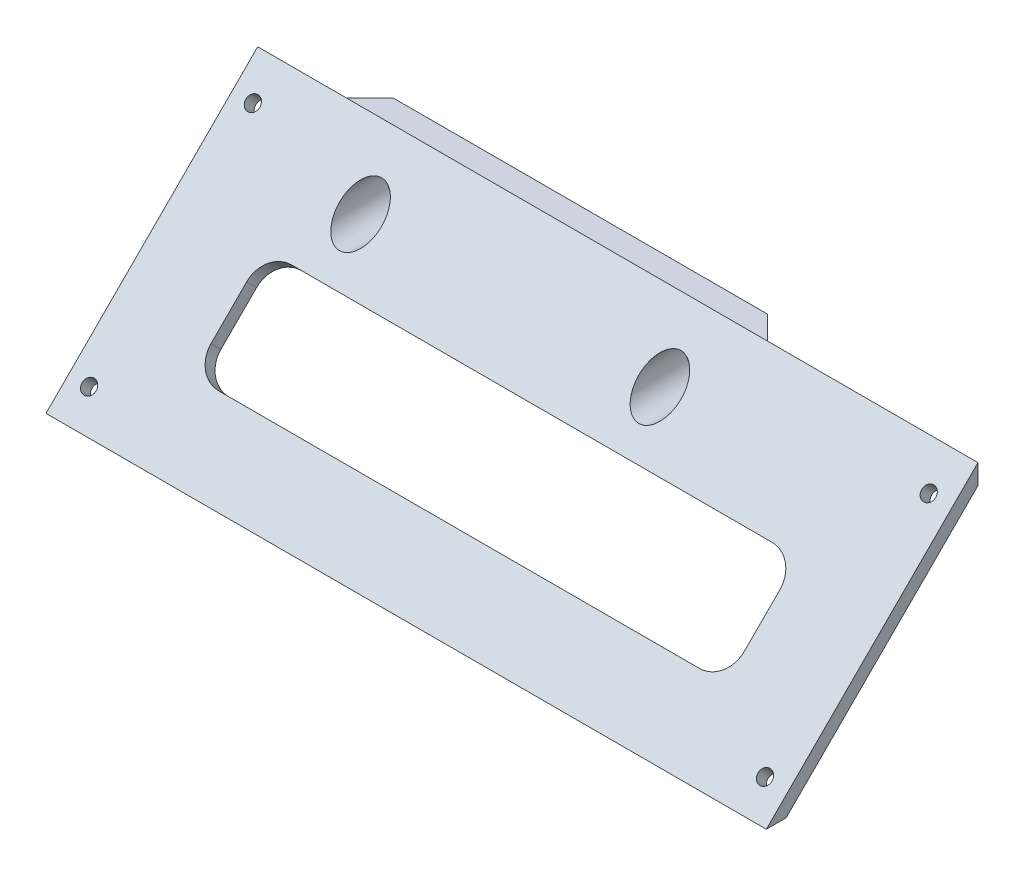
from build123d import *

# Parameters (mm, degrees)
SKETCH1_W                = 80
SKETCH1_H                = 20
BOSS_EXTRUDE1_DEPTH      = 5
BOSS_EXTRUDE2_DEPTH      = 90
BOSS_EXTRUDE2_DEPTH_BACK = 64
SKETCH4_W                = 114
SKETCH4_H                = 22
CUT_EXTRUDE2_DEPTH       = 109.466361883
CHAMFER2_SIZE            = 11.3
CHAMFER2_SIZE_2          = 15.980613255
CHAMFER4_SIZE            = 5
CHAMFER4_SIZE2           = 10.722534603
CUT_EXTRUDE1_DEPTH       = 109.942423601
CUT_EXTRUDE1_DEPTH_BACK  = 109.942423601
SKETCH2_R                = 2.3
SKETCH5_R                = 4.5
CUT_EXTRUDE3_DEPTH       = 107.728174912
SKETCH6_R                = 1.5
CUT_EXTRUDE4_DEPTH       = 5
FILLET2_R                = 5.6


with BuildPart() as part:
    # Sketch1 → Boss-Extrude1 (new body)
    with BuildSketch(Plane.XY):
        Rectangle(SKETCH1_W, SKETCH1_H)
    extrude(amount=BOSS_EXTRUDE1_DEPTH)

    # Sketch3 → Boss-Extrude2 (add, two sides: drawn at the far end of the back side and taken through both)
    with BuildSketch(Plane(origin=(0, 0, 0), x_dir=(0, 0, -1), z_dir=(1, 0, 0)).offset(-BOSS_EXTRUDE2_DEPTH_BACK)):
        Polygon((-5, 10), (-50.254833996, -35.254833996), (-46.012193309, -35.254833996), (-5, 5.757359313), align=None)
    extrude(amount=BOSS_EXTRUDE2_DEPTH + BOSS_EXTRUDE2_DEPTH_BACK)

    # Sketch4 → Cut-Extrude2 (cut, through all)
    with BuildSketch(Plane(origin=(0, 5.378679656, 5.378679656), x_dir=(1, 0, 0), z_dir=(0, -0.7071067811865509, -0.7071067811865441))):
        with Locations((13, 33.464466094)):
            Rectangle(SKETCH4_W, SKETCH4_H)
    extrude(amount=-CUT_EXTRUDE2_DEPTH, mode=Mode.SUBTRACT)

    # Chamfer1
    # the kernel refuses this chamfer: 5 mm, written as the material it adds along each edge
    with BuildSketch(Plane(origin=(40, -25.102836543, 5), x_dir=(-0.027495876610586317, 0, -0.9996219169112968), z_dir=(0, 1, 0))) as chamfer1_piece_1_section:
        with BuildLine():
            Line((5.143365976, 0), (-0.282735774, -5.135588968))
            Line((-0.282735774, -5.135588968), (-0.382697966, -5.13283938))
            ThreePointArc((-0.382697966, -5.13283938), (-0.170646135, -2.566989148), (-0.099962192, 0.002749588))
            Line((-0.099962192, 0.002749588), (0.002749588, 0.099962192))
            ThreePointArc((0.002749588, 0.099962192), (2.572488324, 0.029278248), (5.146115564, 0.099962192))
            Line((5.146115564, 0.099962192), (5.143365976, 0))
        make_face()
    chamfer1_piece_1 = extrude(amount=35.102836543, mode=Mode.PRIVATE)
    chamfer1_piece_1 = split(chamfer1_piece_1, bisect_by=Plane(origin=(41.544288895, -10, 3.190389103), z_dir=(0, 1, 0)), keep=Keep.TOP, mode=Mode.PRIVATE)
    chamfer1_piece_1 = split(chamfer1_piece_1, bisect_by=Plane(origin=(41.544288895, -1.222319508, 0), z_dir=(0, 0, 1)), keep=Keep.TOP, mode=Mode.PRIVATE)
    chamfer1_piece_1 = split(chamfer1_piece_1, bisect_by=Plane(origin=(41.544288895, -1.222319508, 5), z_dir=(0, 0, -1)), keep=Keep.TOP, mode=Mode.PRIVATE)
    chamfer1_piece_1 = split(chamfer1_piece_1, bisect_by=Plane(origin=(41.544288895, 3.172325351, 7.585033962), z_dir=(0, -0.7071067811865511, -0.707106781186544)), keep=Keep.TOP, mode=Mode.PRIVATE)
    add(chamfer1_piece_1)
    with BuildSketch(Plane(origin=(40, -25.102836543, 5), x_dir=(-0.027495876610586317, 0, -0.9996219169112968), z_dir=(0, 1, 0))) as chamfer1_piece_2_section:
        with BuildLine():
            Line((5.143365976, 0), (-0.282735774, -5.135588968))
            Line((-0.282735774, -5.135588968), (-0.382697966, -5.13283938))
            ThreePointArc((-0.382697966, -5.13283938), (-0.170646135, -2.566989148), (-0.099962192, 0.002749588))
            Line((-0.099962192, 0.002749588), (0.002749588, 0.099962192))
            ThreePointArc((0.002749588, 0.099962192), (2.572488324, 0.029278248), (5.146115564, 0.099962192))
            Line((5.146115564, 0.099962192), (5.143365976, 0))
        make_face()
    chamfer1_piece_2 = extrude(amount=35.102836543, mode=Mode.PRIVATE)
    chamfer1_piece_2 = split(chamfer1_piece_2, bisect_by=Plane(origin=(41.882166071, 8.451075781, 5), z_dir=(0, 0, -1)), keep=Keep.TOP, mode=Mode.PRIVATE)
    chamfer1_piece_2 = split(chamfer1_piece_2, bisect_by=Plane(origin=(41.882166071, 7.676613671, 3.080745642), z_dir=(0, 0.7071067811865511, 0.707106781186544)), keep=Keep.TOP, mode=Mode.PRIVATE)
    add(chamfer1_piece_2)
    with BuildSketch(Plane(origin=(40, -25.102836543, 5), x_dir=(-0.027495876610586317, 0, -0.9996219169112968), z_dir=(0, 1, 0))) as chamfer1_piece_3_section:
        with BuildLine():
            Line((5.143365976, 0), (-0.282735774, -5.135588968))
            Line((-0.282735774, -5.135588968), (-0.382697966, -5.13283938))
            ThreePointArc((-0.382697966, -5.13283938), (-0.170646135, -2.566989148), (-0.099962192, 0.002749588))
            Line((-0.099962192, 0.002749588), (0.002749588, 0.099962192))
            ThreePointArc((0.002749588, 0.099962192), (2.572488324, 0.029278248), (5.146115564, 0.099962192))
            Line((5.146115564, 0.099962192), (5.143365976, 0))
        make_face()
    chamfer1_piece_3 = extrude(amount=35.102836543, mode=Mode.PRIVATE)
    chamfer1_piece_3 = split(chamfer1_piece_3, bisect_by=Plane(origin=(43.003980886, 7.808289703, 5), z_dir=(0, 0, 1)), keep=Keep.TOP, mode=Mode.PRIVATE)
    chamfer1_piece_3 = split(chamfer1_piece_3, bisect_by=Plane(origin=(43.003980886, 6.747629531, 4.009729782), z_dir=(0, 0.7071067811865511, 0.707106781186544)), keep=Keep.TOP, mode=Mode.PRIVATE)
    chamfer1_piece_3 = split(chamfer1_piece_3, bisect_by=Plane(origin=(43.003980886, 8.868949875, 6.131050125), z_dir=(0, -0.7071067811865511, -0.7071067811865439)), keep=Keep.TOP, mode=Mode.PRIVATE)
    add(chamfer1_piece_3)
    with BuildSketch(Plane(origin=(-40, 10, 5), x_dir=(0.027495876610586317, 0, -0.9996219169112968), z_dir=(0, -1, 0))) as chamfer1_piece_4_section:
        with BuildLine():
            Line((5.143365976, 0), (-0.282735774, -5.135588968))
            Line((-0.282735774, -5.135588968), (-0.382697966, -5.13283938))
            ThreePointArc((-0.382697966, -5.13283938), (-0.170646135, -2.566989148), (-0.099962192, 0.002749588))
            Line((-0.099962192, 0.002749588), (0.002749588, 0.099962192))
            ThreePointArc((0.002749588, 0.099962192), (2.572488324, 0.029278248), (5.146115564, 0.099962192))
            Line((5.146115564, 0.099962192), (5.143365976, 0))
        make_face()
    chamfer1_piece_4 = extrude(amount=35.102836543, mode=Mode.PRIVATE)
    chamfer1_piece_4 = split(chamfer1_piece_4, bisect_by=Plane(origin=(-41.882166071, 8.451075781, 5), z_dir=(0, 0, -1)), keep=Keep.TOP, mode=Mode.PRIVATE)
    chamfer1_piece_4 = split(chamfer1_piece_4, bisect_by=Plane(origin=(-41.882166071, 7.676613671, 3.080745642), z_dir=(0, 0.7071067811865511, 0.707106781186544)), keep=Keep.TOP, mode=Mode.PRIVATE)
    add(chamfer1_piece_4)
    with BuildSketch(Plane(origin=(-40, 10, 5), x_dir=(0.027495876610586317, 0, -0.9996219169112968), z_dir=(0, -1, 0))) as chamfer1_piece_5_section:
        with BuildLine():
            Line((5.143365976, 0), (-0.282735774, -5.135588968))
            Line((-0.282735774, -5.135588968), (-0.382697966, -5.13283938))
            ThreePointArc((-0.382697966, -5.13283938), (-0.170646135, -2.566989148), (-0.099962192, 0.002749588))
            Line((-0.099962192, 0.002749588), (0.002749588, 0.099962192))
            ThreePointArc((0.002749588, 0.099962192), (2.572488324, 0.029278248), (5.146115564, 0.099962192))
            Line((5.146115564, 0.099962192), (5.143365976, 0))
        make_face()
    chamfer1_piece_5 = extrude(amount=35.102836543, mode=Mode.PRIVATE)
    chamfer1_piece_5 = split(chamfer1_piece_5, bisect_by=Plane(origin=(-43.003980886, 7.808289703, 5), z_dir=(0, 0, 1)), keep=Keep.TOP, mode=Mode.PRIVATE)
    chamfer1_piece_5 = split(chamfer1_piece_5, bisect_by=Plane(origin=(-43.003980886, 6.747629531, 4.009729782), z_dir=(0, 0.7071067811865511, 0.707106781186544)), keep=Keep.TOP, mode=Mode.PRIVATE)
    chamfer1_piece_5 = split(chamfer1_piece_5, bisect_by=Plane(origin=(-43.003980886, 8.868949875, 6.131050125), z_dir=(0, -0.7071067811865511, -0.7071067811865439)), keep=Keep.TOP, mode=Mode.PRIVATE)
    add(chamfer1_piece_5)
    with BuildSketch(Plane(origin=(-40, 10, 5), x_dir=(0.027495876610586317, 0, -0.9996219169112968), z_dir=(0, -1, 0))) as chamfer1_piece_6_section:
        with BuildLine():
            Line((5.143365976, 0), (-0.282735774, -5.135588968))
            Line((-0.282735774, -5.135588968), (-0.382697966, -5.13283938))
            ThreePointArc((-0.382697966, -5.13283938), (-0.170646135, -2.566989148), (-0.099962192, 0.002749588))
            Line((-0.099962192, 0.002749588), (0.002749588, 0.099962192))
            ThreePointArc((0.002749588, 0.099962192), (2.572488324, 0.029278248), (5.146115564, 0.099962192))
            Line((5.146115564, 0.099962192), (5.143365976, 0))
        make_face()
    chamfer1_piece_6 = extrude(amount=35.102836543, mode=Mode.PRIVATE)
    chamfer1_piece_6 = split(chamfer1_piece_6, bisect_by=Plane(origin=(-41.544288895, -10, 3.190389103), z_dir=(0, 1, 0)), keep=Keep.TOP, mode=Mode.PRIVATE)
    chamfer1_piece_6 = split(chamfer1_piece_6, bisect_by=Plane(origin=(-41.544288895, -1.222319508, 0), z_dir=(0, 0, 1)), keep=Keep.TOP, mode=Mode.PRIVATE)
    chamfer1_piece_6 = split(chamfer1_piece_6, bisect_by=Plane(origin=(-41.544288895, -1.222319508, 5), z_dir=(0, 0, -1)), keep=Keep.TOP, mode=Mode.PRIVATE)
    chamfer1_piece_6 = split(chamfer1_piece_6, bisect_by=Plane(origin=(-41.544288895, 3.172325351, 7.585033962), z_dir=(0, -0.7071067811865511, -0.707106781186544)), keep=Keep.TOP, mode=Mode.PRIVATE)
    add(chamfer1_piece_6)

    # Chamfer2
    # the kernel refuses this chamfer: 15.980613255, 11.3 mm, written as the material it adds along each edge
    with BuildSketch(Plane(origin=(86.097071245, 5.757359313, 5), x_dir=(0, -0.6660419652145876, 0.745914271597675), z_dir=(-1, 0, 0))) as chamfer2_piece_1_section:
        Polygon((CHAMFER2_SIZE * 0.998403829789, -CHAMFER2_SIZE * 0.0564782494725), (CHAMFER2_SIZE_2 * 0.666041965207, -CHAMFER2_SIZE_2 * 0.745914271589), (0, 0), align=None)
    chamfer2_piece_1 = extrude(amount=172.194142489, mode=Mode.PRIVATE)
    chamfer2_piece_1 = split(chamfer2_piece_1, bisect_by=Plane(origin=(-23.869417759, -2.230051689, -16.130582241), z_dir=(0.7071067811862721, 0, 0.707106781186823)), keep=Keep.TOP, mode=Mode.PRIVATE)
    chamfer2_piece_1 = split(chamfer2_piece_1, bisect_by=Plane(origin=(23.869417759, -2.230051689, -16.130582241), z_dir=(-0.7071067811862721, 0, 0.707106781186823)), keep=Keep.TOP, mode=Mode.PRIVATE)
    chamfer2_piece_1 = split(chamfer2_piece_1, bisect_by=Plane(origin=(0, -10, 7.738835518), z_dir=(0, 1, 0)), keep=Keep.TOP, mode=Mode.PRIVATE)
    add(chamfer2_piece_1)

    # Chamfer4
    chamfer4_edges = [part.edges().sort_by_distance(p)[0] for p in [
        (0, -2.232947315, 12.990306627),
    ]]
    chamfer4_side = [part.faces().sort_by_distance(p)[0] for p in [
        (0, -6.014099628, 9.209154314),
    ]]
    chamfer(chamfer4_edges, length=CHAMFER4_SIZE, length2=CHAMFER4_SIZE2, reference=chamfer4_side[0])

    # Sketch2 → Cut-Extrude1 (cut, two sides: drawn at the far end of the back side and taken through both)
    with BuildSketch(Plane.XY.offset(-CUT_EXTRUDE1_DEPTH_BACK)):
        with Locations(Location((-32, 0, 0), (0, 0, 270))):
            Circle(SKETCH2_R)
        with Locations(Location((32, 0, 0), (0, 0, 270))):
            Circle(SKETCH2_R)
    extrude(amount=CUT_EXTRUDE1_DEPTH + CUT_EXTRUDE1_DEPTH_BACK, mode=Mode.SUBTRACT)

    # Sketch5 → Cut-Extrude3 (cut, through all)
    with BuildSketch(Plane(origin=(0, 0, 5), x_dir=(-1, 0, 0), z_dir=(0, 0, -1))):
        with Locations((-32, 0)):
            Circle(SKETCH5_R)
        with Locations((32, 0)):
            Circle(SKETCH5_R)
    extrude(amount=-CUT_EXTRUDE3_DEPTH, mode=Mode.SUBTRACT)

    # Sketch6 → Cut-Extrude4 (cut)
    with BuildSketch(Plane(origin=(0, 7.5, 7.5), x_dir=(1, 0, 0), z_dir=(0, 0.7071067811865511, 0.707106781186544))):
        with Locations(Location((-59.55, -4.214466094, 0), (0, 0, 270))):
            Circle(SKETCH6_R)
        with Locations(Location((-59.55, -53.714466094, 0), (0, 0, 270))):
            Circle(SKETCH6_R)
        with Locations(Location((84.95, -53.714466094, 0), (0, 0, 270))):
            Circle(SKETCH6_R)
        with Locations(Location((84.95, -4.214466094, 0), (0, 0, 270))):
            Circle(SKETCH6_R)
    extrude(amount=-CUT_EXTRUDE4_DEPTH, mode=Mode.SUBTRACT)

    # Fillet2
    fillet2_edges = [part.edges().sort_by_distance(p)[0] for p in [
        (-44, -9.445436483, 22.324116139),
        (-44, -25.001785669, 37.880465325),
        (70, -25.001785669, 37.880465325),
        (70, -9.445436483, 22.324116139),
    ]]
    fillet(fillet2_edges, radius=FILLET2_R)


solid = part.part
